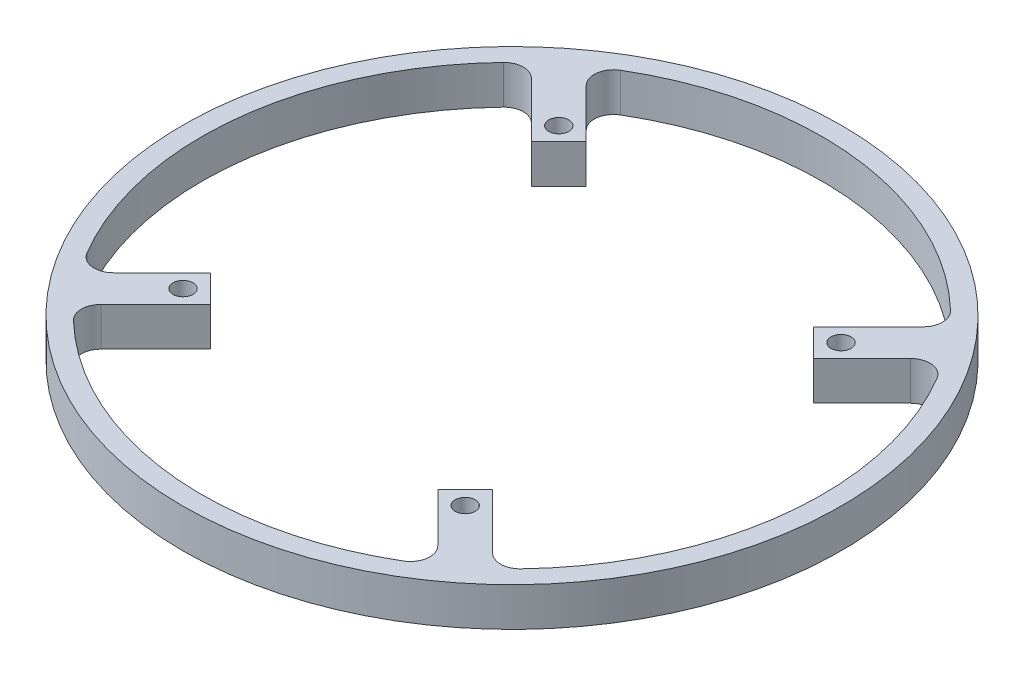
from build123d import *

# Parameters (mm, degrees)
SKETCH2_W                  = 29.99983
SKETCH2_H                  = 10
F_6_0_204_DIAMETER_HOLE1_D = 5.1816
CUT_EXTRUDE1_DEPTH         = 121.623141229
CIRPATTERN1_COUNT          = 4
FILLET1_R                  = 5


with BuildPart() as part:
    # Sketch2 → Revolve1 (revolve)
    with BuildSketch(Plane(origin=(0, 0, 0), x_dir=(0, 0, -1), z_dir=(1, 0, 0))):
        with Locations((-69.999915, 5)):
            Rectangle(SKETCH2_W, SKETCH2_H)
    revolve(axis=Axis((0, 3.678923398, 0), (0, 1, 0)))

    # #6 (0.204) Diameter Hole1 (through all)
    with Locations(Plane(origin=(0, 0, 0), x_dir=(-1, 0, 0), z_dir=(0, -1, 0))):
        with Locations((36.390872965, 48.461940777)):
            f_6_0_204_diameter_hole1 = Hole(F_6_0_204_DIAMETER_HOLE1_D / 2)

    # Sketch14 → Cut-Extrude1 (cut, through all)
    with BuildSketch(Plane.XZ):
        with BuildLine():
            Line((-33.070789849, -38.070789849), (-54.013152452, -59.013152452))
            ThreePointArc((-54.013152452, -59.013152452), (-79.541363053, -8.552447817), (-65.323924788, 46.181789164))
            Line((-65.323924788, 46.181789164), (-55.533008589, 36.390872965))
            Line((-55.533008589, 36.390872965), (-48.461940777, 29.319805153))
            Line((-48.461940777, 29.319805153), (-41.390872965, 36.390872965))
            Line((-41.390872965, 36.390872965), (-38.070789849, 33.070789849))
            ThreePointArc((-38.070789849, 33.070789849), (-50.304693428, -3.535533906), (-33.070789849, -38.070789849))
        make_face()
    cut_extrude1 = extrude(amount=-CUT_EXTRUDE1_DEPTH, mode=Mode.SUBTRACT)

    # CirPattern1: #6 (0.204) Diameter Hole1, Cut-Extrude1 ×4 about axis
    cirpattern1_axis = Axis((0, 3.678923398, 0), (0, 1, 0))
    add([f_6_0_204_diameter_hole1.rotate(cirpattern1_axis, i * 360 / CIRPATTERN1_COUNT) for i in range(1, CIRPATTERN1_COUNT)], mode=Mode.SUBTRACT)
    add([cut_extrude1.rotate(cirpattern1_axis, i * 360 / CIRPATTERN1_COUNT) for i in range(1, CIRPATTERN1_COUNT)], mode=Mode.SUBTRACT)

    # Fillet1
    fillet1_edges = [part.edges().sort_by_distance(p)[0] for p in [
        (54.013152452, 5, 59.013152452),
        (-54.013152452, 5, -59.013152452),
        (59.013152452, 5, -54.013152452),
        (-59.013152452, 5, 54.013152452),
        (46.181789164, 5, 65.323924788),
        (65.323924788, 5, -46.181789164),
        (-46.181789164, 5, -65.323924788),
        (-65.323924788, 5, 46.181789164),
    ]]
    fillet(fillet1_edges, radius=FILLET1_R)


solid = part.part
